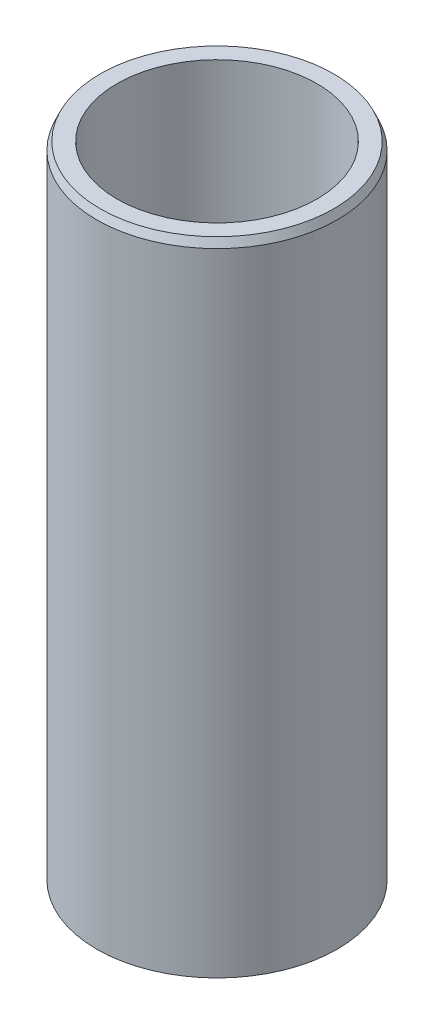
from build123d import *
from OCP.BRepFilletAPI import BRepFilletAPI_MakeChamfer

# Parameters (mm, degrees)
SKETCH1_R           = 55
BOSS_EXTRUDE1_DEPTH = 293.954693321
SKETCH2_R           = 45.714881758
CUT_EXTRUDE1_DEPTH  = 305.071310263
CHAMFER1_SIZE       = 3.599488763
CHAMFER1_SIZE2      = 1.583764898


with BuildPart() as part:
    # Sketch1 → Boss-Extrude1 (new body)
    with BuildSketch(Plane(origin=(0, 0, 0), x_dir=(1, 0, 0), z_dir=(0, 1, 0))):
        Circle(SKETCH1_R)
    extrude(amount=BOSS_EXTRUDE1_DEPTH)

    # Sketch2 → Cut-Extrude1 (cut, through all)
    with BuildSketch(Plane(origin=(0, 0, 0), x_dir=(1, 0, 0), z_dir=(0, 1, 0))):
        Circle(SKETCH2_R)
    extrude(amount=CUT_EXTRUDE1_DEPTH, mode=Mode.SUBTRACT)

    # Chamfer1: one chamfer whose edges measure the first distance from different faces: ONE call of the kernel's chamfer builder (chamfer() names one face for all edges)
    chamfer1_edges_1 = [part.edges().sort_by_distance(p)[0] for p in [
        (-55, 293.954693321, 0),
    ]]
    chamfer1_side_1 = [part.faces().sort_by_distance(p)[0] for p in [
        (-55, 146.97734666, 0),
    ]]
    chamfer1_edges_2 = [part.edges().sort_by_distance(p)[0] for p in [
        (-55, 0, 0),
    ]]
    chamfer1_side_2 = [part.faces().sort_by_distance(p)[0] for p in [
        (-53.444365081, 0, 0),
    ]]
    chamfer1 = BRepFilletAPI_MakeChamfer(part.part.solid().wrapped)
    for e in chamfer1_edges_1:
        chamfer1.Add(CHAMFER1_SIZE, CHAMFER1_SIZE2, e.wrapped, chamfer1_side_1[0].wrapped)  # the first distance lies on this face
    for e in chamfer1_edges_2:
        chamfer1.Add(CHAMFER1_SIZE, CHAMFER1_SIZE2, e.wrapped, chamfer1_side_2[0].wrapped)  # the first distance lies on this face
    add(Compound.cast(chamfer1.Shape()), mode=Mode.REPLACE)


solid = part.part
